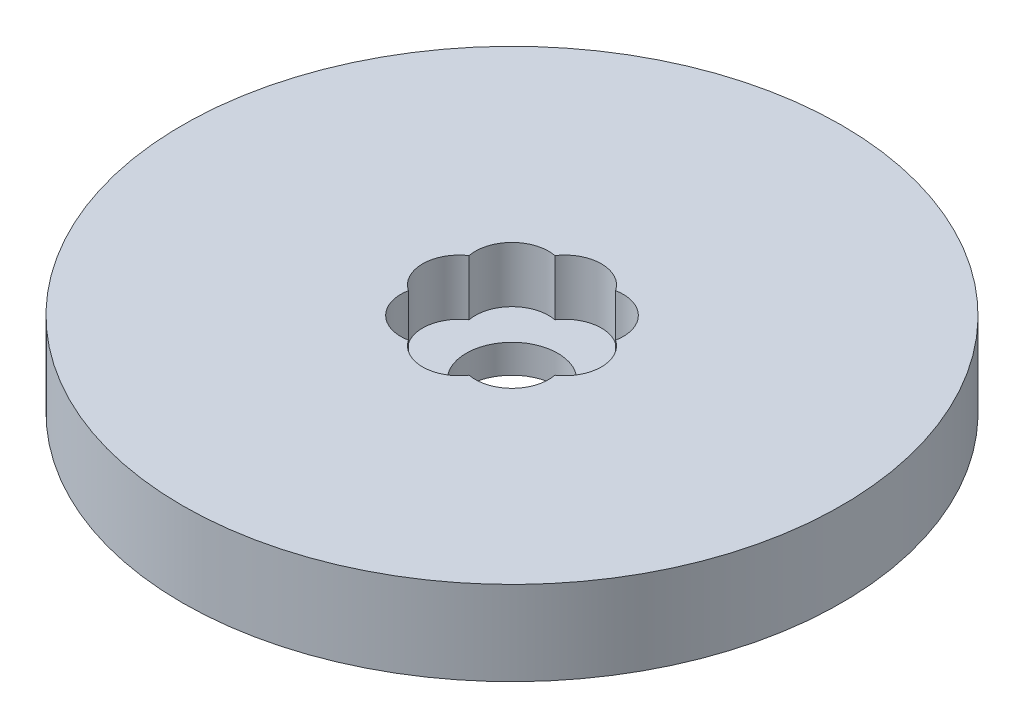
from build123d import *

# Parameters (mm, degrees)
SKETCH1_R           = 90
BOSS_EXTRUDE1_DEPTH = 23
SKETCH2_R           = 12.5
CUT_EXTRUDE1_DEPTH  = 130.340635533
SKETCH3_R           = 10
CUT_EXTRUDE2_DEPTH  = 15.193840242
CIRPATTERN1_COUNT   = 8


with BuildPart() as part:
    # Sketch1 → Boss-Extrude1 (new body)
    with BuildSketch(Plane(origin=(0, 0, 0), x_dir=(1, 0, 0), z_dir=(0, 1, 0))):
        Circle(SKETCH1_R)
    extrude(amount=BOSS_EXTRUDE1_DEPTH)

    # Sketch2 → Cut-Extrude1 (cut, through all)
    with BuildSketch(Plane(origin=(0, 0, 0), x_dir=(1, 0, 0), z_dir=(0, 1, 0))):
        Circle(SKETCH2_R)
    extrude(amount=CUT_EXTRUDE1_DEPTH, mode=Mode.SUBTRACT)

    # Sketch3 → Cut-Extrude2 (cut)
    with BuildSketch(Plane(origin=(0, 23, 0), x_dir=(1, 0, 0), z_dir=(0, 1, 0))):
        with Locations((-14.407608976, 0)):
            Circle(SKETCH3_R)
    cut_extrude2 = extrude(amount=-CUT_EXTRUDE2_DEPTH, mode=Mode.SUBTRACT)

    # CirPattern1: Cut-Extrude2 ×8 about axis
    cirpattern1_axis = Axis((0, 0, 0), (0, 1, 0))
    for i in range(1, CIRPATTERN1_COUNT):
        add(cut_extrude2.rotate(cirpattern1_axis, i * 360 / CIRPATTERN1_COUNT), mode=Mode.SUBTRACT)


solid = part.part
